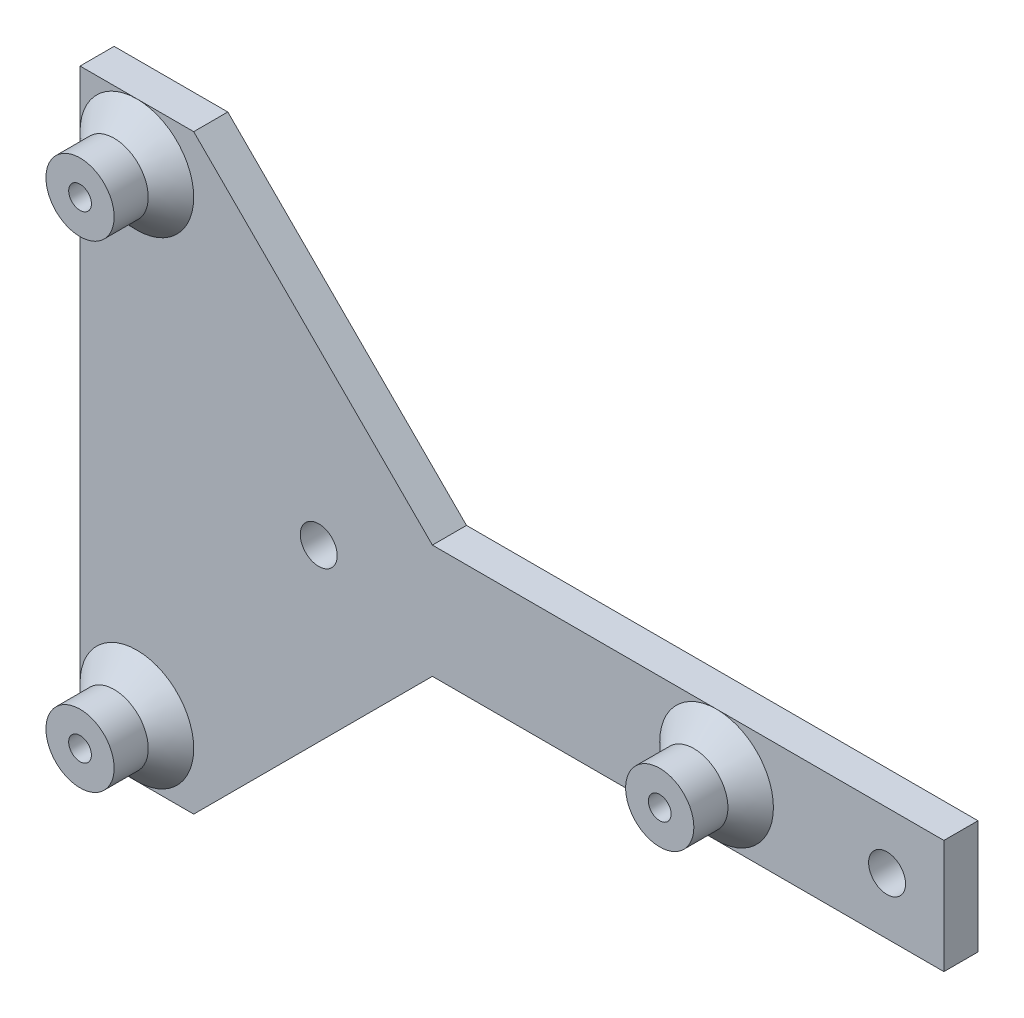
from build123d import *

# Parameters (mm, degrees)
CROQUIS1_W                = 10
CROQUIS1_H                = 10
CROQUIS1_R                = 1.625
SALIENTE_EXTRUIR1_DEPTH   = 3
SALIENTE_EXTRUIR1_2_DEPTH = 3
CROQUIS2_W                = 40
CROQUIS2_H                = 10
CROQUIS2_R                = 1
SALIENTE_EXTRUIR2_DEPTH   = 3
SALIENTE_EXTRUIR3_START   = 5
CROQUIS3_R                = 3
CROQUIS3_R_2              = 1
SALIENTE_EXTRUIR3_DEPTH   = 5
CHAFL_N1_SIZE             = 2
CHAFL_N2_SIZE             = 21


with BuildPart() as part:
    # Croquis1 → Saliente-Extruir1 (new body)
    with BuildSketch(Plane.XY):
        Rectangle(CROQUIS1_W, CROQUIS1_H)
        Circle(CROQUIS1_R, mode=Mode.SUBTRACT)
    extrude(amount=SALIENTE_EXTRUIR1_DEPTH)



with BuildPart() as body_2:
    # Croquis1 → Saliente-Extruir1 2 (new body)
    with BuildSketch(Plane.XY):
        with Locations((-50, 0)):
            Rectangle(CROQUIS1_W, CROQUIS1_H)
        with Locations((-50, 0)):
            Circle(CROQUIS1_R, mode=Mode.SUBTRACT)
    extrude(amount=SALIENTE_EXTRUIR1_2_DEPTH)


with BuildPart() as part_1:
    add(part.part)

    add(body_2.part)  # Saliente-Extruir2 merges body 2
    # Croquis2 → Saliente-Extruir2 (add)
    # profile 1 of 2: a face of its own
    with BuildSketch(Plane.XY.offset(3)):
        with Locations((-25, 0)):
            Rectangle(CROQUIS2_W, CROQUIS2_H)
        with Locations((-15, 0)):
            Circle(CROQUIS2_R, mode=Mode.SUBTRACT)
    # profile 2 of 2: a face of its own
    with BuildSketch(Plane.XY.offset(3)):
        Polygon((-61, -5), (-61, -26), (-71, -26), (-71, 26), (-61, 26), (-61, 5), (-55, 5), (-55, -5), align=None)
        with Locations((-66, 21)):
            Circle(CROQUIS2_R, mode=Mode.SUBTRACT)
        with Locations((-66, -21)):
            Circle(CROQUIS2_R, mode=Mode.SUBTRACT)
    extrude(amount=-SALIENTE_EXTRUIR2_DEPTH)

    # Croquis3 → Saliente-Extruir3 (add)
    # profile 1 of 3: a face of its own
    with BuildSketch(Plane.XY.offset(3).offset(SALIENTE_EXTRUIR3_START)):
        with Locations((-66, 21)):
            Circle(CROQUIS3_R)
        with Locations((-66, 21)):
            Circle(CROQUIS3_R_2, mode=Mode.SUBTRACT)
    # profile 2 of 3: a face of its own
    with BuildSketch(Plane.XY.offset(3).offset(SALIENTE_EXTRUIR3_START)):
        with Locations((-66, -21)):
            Circle(CROQUIS3_R)
        with Locations((-66, -21)):
            Circle(CROQUIS3_R_2, mode=Mode.SUBTRACT)
    # profile 3 of 3: a face of its own
    with BuildSketch(Plane.XY.offset(3).offset(SALIENTE_EXTRUIR3_START)):
        with Locations((-15, 0)):
            Circle(CROQUIS3_R)
        with Locations((-15, 0)):
            Circle(CROQUIS3_R_2, mode=Mode.SUBTRACT)
    extrude(amount=-SALIENTE_EXTRUIR3_DEPTH)

    # Chaflán1
    chafl_n1_edges = [part_1.edges().sort_by_distance(p)[0] for p in [
        (-69, 21, 3),
        (-69, -21, 3),
        (-18, 0, 3),
    ]]
    chamfer(chafl_n1_edges, length=CHAFL_N1_SIZE - 0.0001)  # a hair under: the kernel refuses the full size

    # Chaflán2
    chafl_n2_edges = [part_1.edges().sort_by_distance(p)[0] for p in [
        (-61, 5, 1.5),
        (-61, -5, 1.5),
    ]]
    chamfer(chafl_n2_edges, length=CHAFL_N2_SIZE - 0.0001)  # a hair under: the kernel refuses the full size


solid = part_1.part
